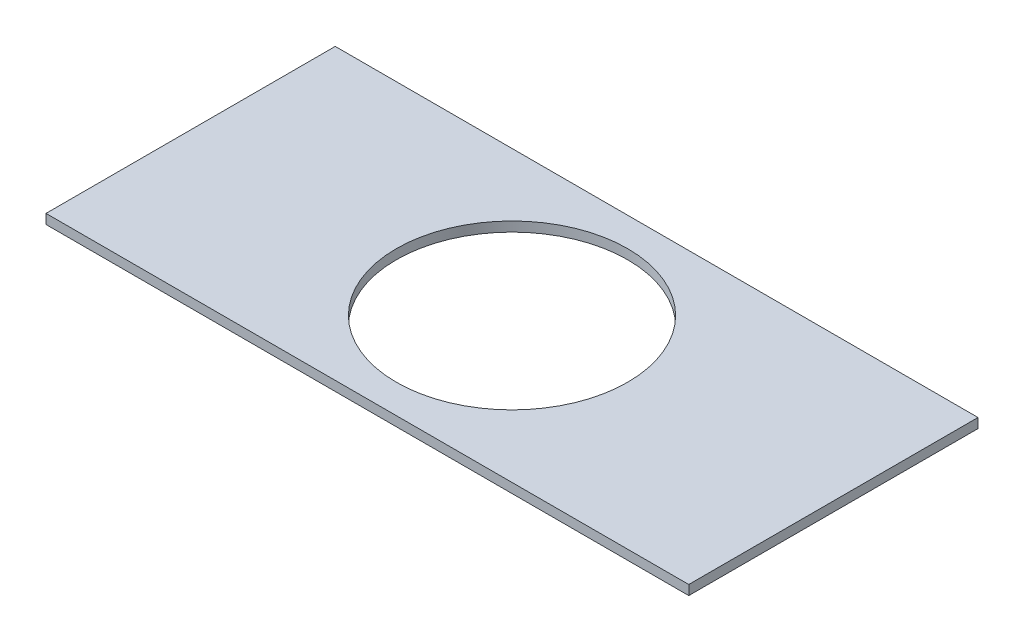
from build123d import *

# Parameters (mm, degrees)
SKETCH1_W           = 200
SKETCH1_H           = 90
SKETCH1_R           = 36
BOSS_EXTRUDE1_DEPTH = 3


with BuildPart() as part:
    # Sketch1 → Boss-Extrude1 (new body)
    with BuildSketch(Plane(origin=(0, 0, 0), x_dir=(1, 0, 0), z_dir=(0, 1, 0))):
        with Locations((100, 45)):
            Rectangle(SKETCH1_W, SKETCH1_H)
        with Locations((100, 45)):
            Circle(SKETCH1_R, mode=Mode.SUBTRACT)
    extrude(amount=BOSS_EXTRUDE1_DEPTH)


solid = part.part
